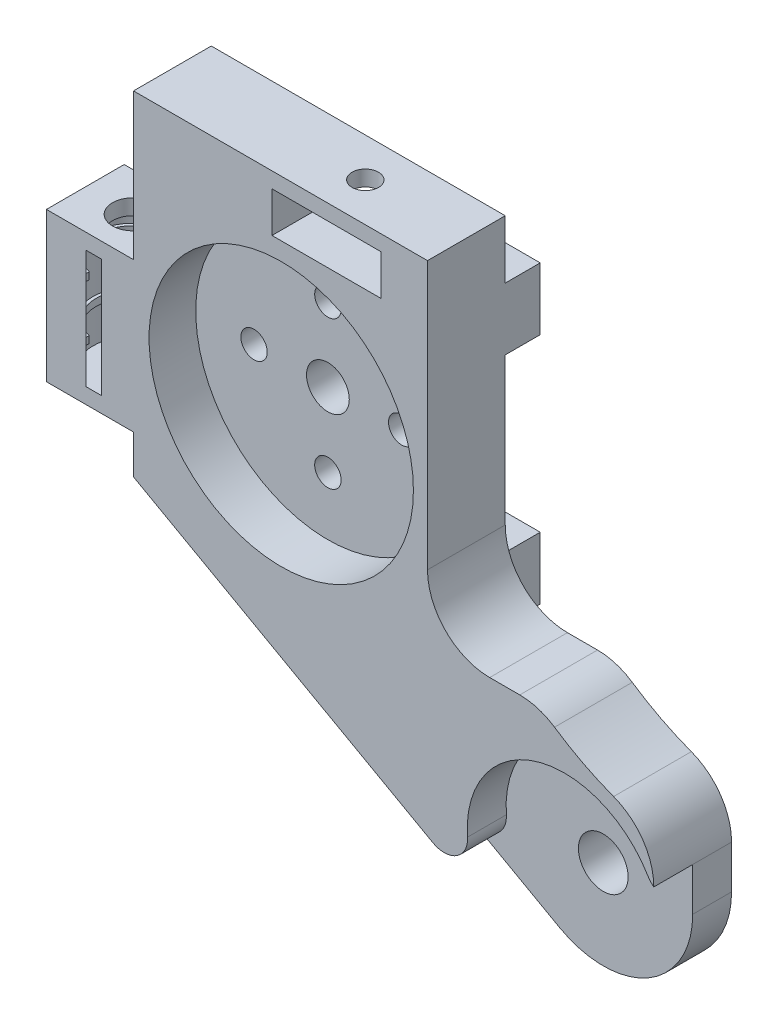
from build123d import *

# Parameters (mm, degrees)
SKETCH1_W                 = 5.2
SKETCH1_H                 = 14
SKETCH1_R                 = 3.2
SKETCH1_R_2               = 1.7
SKETCH1_R_3               = 2.75
BOSS_EXTRUDE1_DEPTH       = 10
SKETCH2_R                 = 2.6
CUT_EXTRUDE1_DEPTH        = 20
SKETCH3_R                 = 5.1
CUT_EXTRUDE2_DEPTH        = 15.2
BOSS_EXTRUDE2_DEPTH       = 0.45
BOSS_EXTRUDE2_DEPTH_BACK  = 0.45
SKETCH4_R                 = 5.1
SKETCH4_R_2               = 4.7
BOSS_EXTRUDE3_DEPTH       = 0.45
BOSS_EXTRUDE3_DEPTH_BACK  = 0.45
SKETCH5_R                 = 5.1
SKETCH5_R_2               = 4.7
CUT_EXTRUDE3_START        = -11
CUT_EXTRUDE3_OUTLINE_W    = 2.009975124
CUT_EXTRUDE3_OUTLINE_H    = 0.9
CUT_EXTRUDE3_OUTLINE_W_2  = 3
CUT_EXTRUDE3_OUTLINE_H_2  = 19.2
CUT_EXTRUDE3_DEPTH        = 12
SKETCH7_R                 = 12.5
CUT_EXTRUDE4_DEPTH        = 1
SKETCH8_R                 = 9.6
CUT_EXTRUDE5_DEPTH        = 1
SKETCH11_R                = 17
CUT_EXTRUDE6_DEPTH        = 6
BOSS_EXTRUDE4_OUTLINE_W   = 7.810507711
BOSS_EXTRUDE4_OUTLINE_H   = 8
BOSS_EXTRUDE4_OUTLINE_W_2 = 8
BOSS_EXTRUDE4_DEPTH       = 4.5
SKETCH13_R                = 2.125
CUT_EXTRUDE7_DEPTH        = 9.5
SKETCH16_W                = 0.189492289
SKETCH16_H                = 3.060913179
CUT_EXTRUDE8_DEPTH        = 4.5
FILLET1_R                 = 8
SKETCH19_R                = 12.5
CUT_EXTRUDE9_DEPTH        = 5
FILLET3_R                 = 3
CUT_EXTRUDE10_REACH       = 116.689
SKETCH20_R                = 1.7


with BuildPart() as part:
    # Sketch1 → Boss-Extrude1 (new body)
    with BuildSketch(Plane(origin=(0, 0, 0), x_dir=(0, 1, 0), z_dir=(0, 0, 1))):
        with BuildLine():
            Line((44.859200041, 91.5), (44.859200041, 77.3))
            Line((44.859200041, 77.3), (39.859200041, 77.3))
            Line((39.859200041, 77.3), (12.058048672, 27.485891377))
            ThreePointArc((12.058048672, 27.485891377), (12.182830244, 16.059150365), (22.1, 10.381499035))
            Line((22.1, 10.381499035), (33.6, 10.381499035))
            ThreePointArc((33.6, 10.381499035), (36.198905176, 18.091500699), (40.42011322, 25.047062246))
            Line((40.42011322, 25.047062246), (40.42011322, 39.489492289))
            Line((40.42011322, 39.489492289), (82.859200041, 39.489492289))
            Line((82.859200041, 39.489492289), (82.859200041, 77.3))
            Line((82.859200041, 77.3), (64.059200041, 77.3))
            Line((64.059200041, 77.3), (64.059200041, 91.5))
            Line((64.059200041, 91.5), (44.859200041, 91.5))
        make_face()
        with Locations((78.259200041, 52.489492289)):
            Rectangle(SKETCH1_W, SKETCH1_H, mode=Mode.SUBTRACT)
        with Locations(Location((22.1, 21.881499035, 0), (0, 0, 270))):
            Circle(SKETCH1_R, mode=Mode.SUBTRACT)
        with Locations(Location((65.859200041, 58.3, 0), (0, 0, 270))):
            Circle(SKETCH1_R_2, mode=Mode.SUBTRACT)
        with Locations(Location((56.359200041, 48.8, 0), (0, 0, 270))):
            Circle(SKETCH1_R_2, mode=Mode.SUBTRACT)
        with Locations(Location((46.859200041, 58.3, 0), (0, 0, 270))):
            Circle(SKETCH1_R_2, mode=Mode.SUBTRACT)
        with Locations(Location((56.359200041, 58.3, 0), (0, 0, 270))):
            Circle(SKETCH1_R_3, mode=Mode.SUBTRACT)
        with Locations(Location((56.359200041, 67.8, 0), (0, 0, 270))):
            Circle(SKETCH1_R_2, mode=Mode.SUBTRACT)
    extrude(amount=BOSS_EXTRUDE1_DEPTH)

    # Sketch2 → Cut-Extrude1 (cut)
    with BuildSketch(Plane.XZ.offset(-44.859200041)):
        with Locations(Location((-82.4, 5, 0), (0, 0, 270))):
            Circle(SKETCH2_R)
    extrude(amount=-CUT_EXTRUDE1_DEPTH, mode=Mode.SUBTRACT)

    # Sketch3 → Cut-Extrude2 (cut)
    with BuildSketch(Plane(origin=(0, 46.859200041, 0), x_dir=(-1, 0, 0), z_dir=(0, -1, 0))):
        with Locations((82.4, -5)):
            Circle(SKETCH3_R)
    extrude(amount=-CUT_EXTRUDE2_DEPTH, mode=Mode.SUBTRACT)

    # Sketch4 → Boss-Extrude2 (add, two sides: drawn at the far end of the back side and taken through both)
    with BuildSketch(Plane(origin=(0, 51.909200041, 0), x_dir=(-1, 0, 0), z_dir=(0, -1, 0)).offset(-BOSS_EXTRUDE2_DEPTH_BACK)):
        with Locations((82.4, -5)):
            Circle(SKETCH4_R)
        with Locations(Location((82.4, -5, 0), (0, 0, 90))):
            Circle(SKETCH4_R_2, mode=Mode.SUBTRACT)
    extrude(amount=BOSS_EXTRUDE2_DEPTH + BOSS_EXTRUDE2_DEPTH_BACK)

    # Sketch5 → Boss-Extrude3 (add, two sides: drawn at the far end of the back side and taken through both)
    with BuildSketch(Plane(origin=(0, 59.009200041, 0), x_dir=(1, 0, 0), z_dir=(0, 1, 0)).offset(-BOSS_EXTRUDE3_DEPTH_BACK)):
        with Locations((-82.4, -5)):
            Circle(SKETCH5_R)
        with Locations(Location((-82.4, -5, 0), (0, 0, 90))):
            Circle(SKETCH5_R_2, mode=Mode.SUBTRACT)
    extrude(amount=BOSS_EXTRUDE3_DEPTH + BOSS_EXTRUDE3_DEPTH_BACK)

    # Cut-Extrude3: read off the stored shape, not the designer's step
    # Cut-Extrude3 outline → Cut-Extrude3 (cut)
    with BuildSketch(Plane.XY.offset(10).offset(CUT_EXTRUDE3_START)):
        with Locations((-82.4, 59.009200041)):
            Rectangle(CUT_EXTRUDE3_OUTLINE_W, CUT_EXTRUDE3_OUTLINE_H)
        with Locations((-82.4, 51.909200041)):
            Rectangle(CUT_EXTRUDE3_OUTLINE_W, CUT_EXTRUDE3_OUTLINE_H)
        with Locations((-90, 54.459200041)):
            Rectangle(CUT_EXTRUDE3_OUTLINE_W_2, CUT_EXTRUDE3_OUTLINE_H_2)
    extrude(amount=CUT_EXTRUDE3_DEPTH, mode=Mode.SUBTRACT)

    # Sketch7 → Cut-Extrude4 (cut)
    with BuildSketch(Plane.XY.offset(10)):
        with Locations((-21.881499035, 22.1)):
            Circle(SKETCH7_R)
    extrude(amount=-CUT_EXTRUDE4_DEPTH, mode=Mode.SUBTRACT)

    # Sketch8 → Cut-Extrude5 (cut)
    with BuildSketch(Plane.XY.offset(9)):
        with Locations((-21.881499035, 22.1)):
            Circle(SKETCH8_R)
    extrude(amount=-CUT_EXTRUDE5_DEPTH, mode=Mode.SUBTRACT)

    # Sketch11 → Cut-Extrude6 (cut)
    with BuildSketch(Plane.XY.offset(10)):
        with Locations((-58.3, 56.359200041)):
            Circle(SKETCH11_R)
    extrude(amount=-CUT_EXTRUDE6_DEPTH, mode=Mode.SUBTRACT)

    # Boss-Extrude4: read off the stored shape, not the designer's step
    # Boss-Extrude4 outline → Boss-Extrude4 (add)
    with BuildSketch(Plane(origin=(0, 0, 0), x_dir=(1, 0, 0), z_dir=(0, 0, -1))):
        with Locations((-43.394746145, -71.359200041)):
            Rectangle(BOSS_EXTRUDE4_OUTLINE_W, BOSS_EXTRUDE4_OUTLINE_H)
        Polygon((-47.3, -45.359200041), (-39.489492289, -45.359200041), (-39.489492289, -40.42011322), (-39.3, -40.42011322), (-39.3, -37.359200041), (-47.3, -37.359200041), align=None)
        with Locations((-73.3, -71.359200041)):
            Rectangle(BOSS_EXTRUDE4_OUTLINE_W_2, BOSS_EXTRUDE4_OUTLINE_H)
        with Locations((-73.3, -41.359200041)):
            Rectangle(BOSS_EXTRUDE4_OUTLINE_W_2, BOSS_EXTRUDE4_OUTLINE_H)
    extrude(amount=BOSS_EXTRUDE4_DEPTH)

    # Sketch13 → Cut-Extrude7 (cut)
    with BuildSketch(Plane(origin=(0, 0, -4.5), x_dir=(1, 0, 0), z_dir=(0, 0, -1))):
        with Locations(Location((-43.3, -41.359200041, 0), (0, 0, 180))):
            Circle(SKETCH13_R)
        with Locations(Location((-43.3, -71.359200041, 0), (0, 0, 180))):
            Circle(SKETCH13_R)
        with Locations(Location((-73.3, -71.359200041, 0), (0, 0, 180))):
            Circle(SKETCH13_R)
        with Locations(Location((-73.3, -41.359200041, 0), (0, 0, 180))):
            Circle(SKETCH13_R)
    extrude(amount=-CUT_EXTRUDE7_DEPTH, mode=Mode.SUBTRACT)

    # Sketch16 → Cut-Extrude8 (cut)
    with BuildSketch(Plane(origin=(0, 0, -4.5), x_dir=(1, 0, 0), z_dir=(0, 0, -1))):
        with Locations((-39.394746145, -38.88965663)):
            Rectangle(SKETCH16_W, SKETCH16_H)
    extrude(amount=-CUT_EXTRUDE8_DEPTH, mode=Mode.SUBTRACT)

    # Fillet1
    # the kernel refuses this fillet: 8 mm, written as the material it adds along each edge
    with BuildSketch(Plane(origin=(-39.489492289, 40.42011322, 0), x_dir=(0, 1, 0), z_dir=(0, 0, 1))) as fillet1_piece_1:
        with BuildLine():
            CenterArc((FILLET1_R, -FILLET1_R), FILLET1_R, 90, 90)
            Line((0, -FILLET1_R), (0, 0))
            Line((0, 0), (FILLET1_R, 0))
        make_face()
    extrude(amount=10)
    # the kernel refuses this fillet: 8 mm, written as the material it takes off along each edge
    with BuildSketch(Plane(origin=(-25.047062246, 40.42011322, -6.434675881), x_dir=(-1, 0, 0), z_dir=(0, 0, 1))) as fillet1_2_piece_1:
        with BuildLine():
            CenterArc((2.573870352, 8), FILLET1_R, 236.049500449, 33.950499551)
            ThreePointArc((-1.893941258, 1.363836996), (-0.936214399, 0.696855523), (0, 0))
            Line((0, 0), (2.573870352, 0))
        make_face()
    extrude(amount=22.869351762, mode=Mode.SUBTRACT)
    with BuildSketch(Plane(origin=(-10.381499035, 33.6, -14.879687817), x_dir=(-0.9588293573098585, 0.2839828578642794, 0), z_dir=(0, 0, 1))) as fillet1_2_piece_2:
        with BuildLine():
            CenterArc((5.98040435, 7.978695466), FILLET1_R, 196.498058708, 69.319545905)
            Line((-1.690230508, 5.706832603), (0, 0))
            ThreePointArc((0, 0), (2.698475134, 0.098533472), (5.396950267, 0))
        make_face()
    extrude(amount=39.759375634, mode=Mode.SUBTRACT)

    # Sketch19 → Cut-Extrude9 (cut)
    with BuildSketch(Plane.XY.offset(10)):
        with Locations((-21.881499035, 22.1)):
            Circle(SKETCH19_R)
    extrude(amount=-CUT_EXTRUDE9_DEPTH, mode=Mode.SUBTRACT)

    # Fillet3
    # the kernel refuses this fillet: 3 mm, written as the material it takes off along each edge
    with BuildSketch(Plane(origin=(-10.381499035, 26.998979486, 14.214960222), x_dir=(9.684312598090364e-12, 1.0, -1.847411112972132e-14), z_dir=(0, 0, -1))) as fillet3_piece_1:
        with BuildLine():
            CenterArc((3.039490322, 1.812802001), FILLET3_R, 217.17613817, 22.016092035)
            ThreePointArc((1.503012295, -0.763869354), (0.76439954, -0.356565251), (0, 0))
            Line((0, 0), (0.649145388, 0))
        make_face()
    extrude(amount=9.214960222, mode=Mode.SUBTRACT)
    with BuildSketch(Plane(origin=(-31.763744729, 14.445509812, 5), x_dir=(-0.35715309500497466, 0.9340458590071301, -7.501643631045315e-14), z_dir=(0, 0, 1))) as fillet3_piece_2:
        with BuildLine():
            CenterArc((8.109181309, 2.871430927), FILLET3_R, 129.90874339, 123.256431286)
            Line((6.184481226, 5.172632698), (0, 0))
            ThreePointArc((0, 0), (3.620170227, 0.53570447), (7.240340454, 0))
        make_face()
    extrude(amount=25.156254778, mode=Mode.SUBTRACT)

    # Sketch20 → Cut-Extrude10 (cut, up to next)
    with BuildSketch(Plane(origin=(0, 82.859200041, 0), x_dir=(-1, 0, 0), z_dir=(0, 1, 0)), mode=Mode.PRIVATE) as cut_extrude10_sk1:
        with Locations(Location((52.489492289, 5, 0), (0, 0, 90))):
            Circle(SKETCH20_R)
    cut_extrude10_tool1 = extrude(cut_extrude10_sk1.sketch, amount=-CUT_EXTRUDE10_REACH, mode=Mode.PRIVATE) & part.part
    add(cut_extrude10_tool1.solids().sort_by_distance((-52.489492, 82.8592, 5))[0], mode=Mode.SUBTRACT)


solid = part.part
